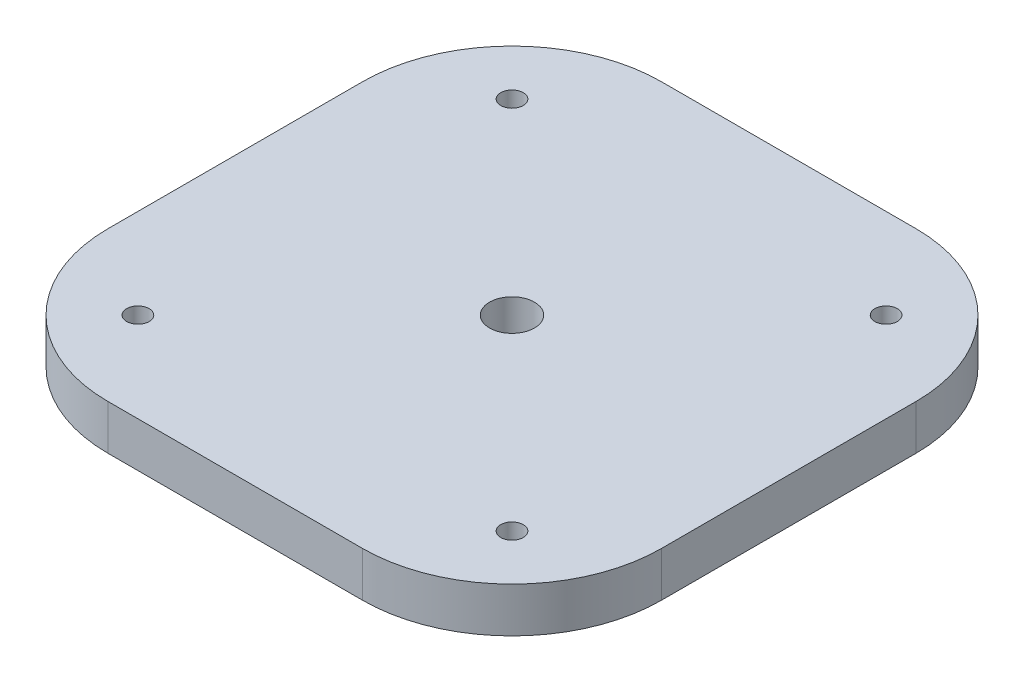
from build123d import *

# Parameters (mm, degrees)
EXTRUDE_1_DEPTH     = 6
SKETCH_2_R          = 1.5
SKETCH_2_R_2        = 3
CUT_EXTRUDE_1_DEPTH = 6
CUT_EXTRUDE_2_DEPTH = 2


with BuildPart() as part:
    # Эскиз1 → Бобышка-Вытянуть1 (new body)
    with BuildSketch(Plane(origin=(0, 0, 0), x_dir=(1, 0, 0), z_dir=(0, 1, 0))):
        with BuildLine():
            Line((17, -37), (-17, -37))
            ThreePointArc((-17, -37), (-31.142135624, -31.142135624), (-37, -17))
            Line((-37, -17), (-37, 17))
            ThreePointArc((-37, 17), (-31.142135624, 31.142135624), (-17, 37))
            Line((-17, 37), (17, 37))
            ThreePointArc((17, 37), (31.142135624, 31.142135624), (37, 17))
            Line((37, 17), (37, -17))
            ThreePointArc((37, -17), (31.142135624, -31.142135624), (17, -37))
        make_face()
    extrude(amount=EXTRUDE_1_DEPTH)

    # Эскиз2 → Вырез-Вытянуть1 (cut)
    with BuildSketch(Plane(origin=(0, 0, 0), x_dir=(1, 0, 0), z_dir=(0, 1, 0))):
        with Locations((-25, 25)):
            Circle(SKETCH_2_R)
        with Locations((25, 25)):
            Circle(SKETCH_2_R)
        with Locations((25, -25)):
            Circle(SKETCH_2_R)
        with Locations((-25, -25)):
            Circle(SKETCH_2_R)
        Circle(SKETCH_2_R_2)
    extrude(amount=CUT_EXTRUDE_1_DEPTH, mode=Mode.SUBTRACT)

    # Эскиз3 → Вырез-Вытянуть2 (cut)
    with BuildSketch(Plane(origin=(0, 0, 0), x_dir=(1, 0, 0), z_dir=(0, 1, 0))):
        Polygon((-26.732050808, 28), (-28.464101615, 25), (-26.732050808, 22), (-23.267949192, 22), (-21.535898385, 25), (-23.267949192, 28), align=None)
        Polygon((23.267949192, 28), (21.535898385, 25), (23.267949192, 22), (26.732050808, 22), (28.464101615, 25), (26.732050808, 28), align=None)
        Polygon((23.267949192, -22), (21.535898385, -25), (23.267949192, -28), (26.732050808, -28), (28.464101615, -25), (26.732050808, -22), align=None)
        Polygon((-26.732050808, -22), (-28.464101615, -25), (-26.732050808, -28), (-23.267949192, -28), (-21.535898385, -25), (-23.267949192, -22), align=None)
    extrude(amount=CUT_EXTRUDE_2_DEPTH, mode=Mode.SUBTRACT)


solid = part.part
